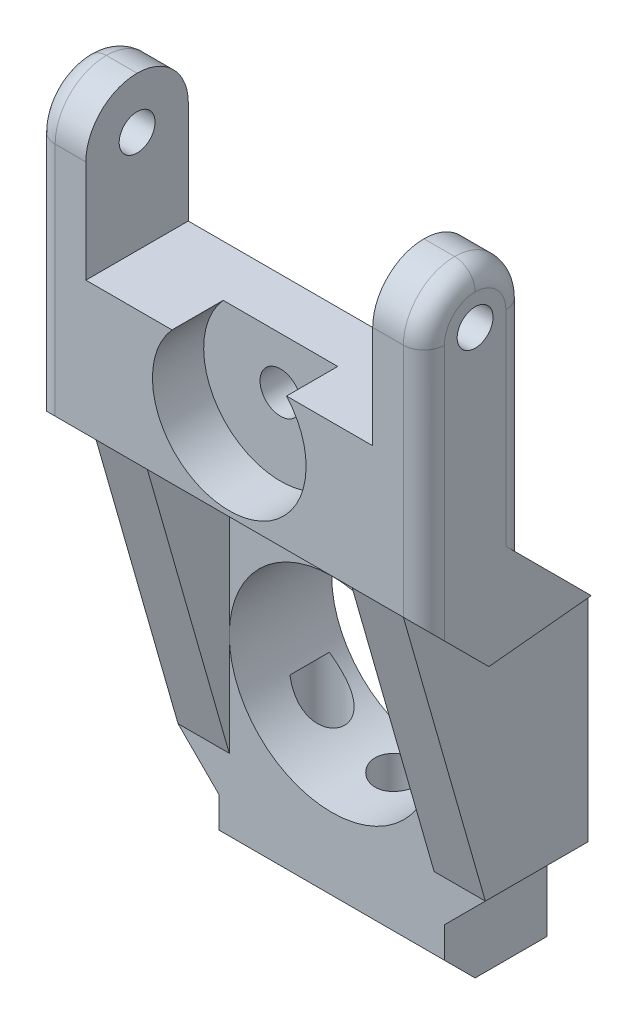
from build123d import *

# Parameters (mm, degrees)
SKETCH1_W           = 30
SKETCH1_H           = 31
BOSS_EXTRUDE1_DEPTH = 10
SKETCH2_W           = 4
SKETCH2_H           = 10
CUT_EXTRUDE1_DEPTH  = 10
CHAMFER1_SIZE       = 4
SKETCH3_R           = 2.25
CUT_EXTRUDE2_DEPTH  = 15
CHAMFER2_SIZE       = 1
SKETCH4_R           = 10
CUT_EXTRUDE3_DEPTH  = 24.774986856
BOSS_EXTRUDE2_DEPTH = 19
CHAMFER3_SIZE       = 4
SKETCH6_W           = 28
SKETCH6_H           = 10
CUT_EXTRUDE4_DEPTH  = 15
FILLET1_R           = 5
SKETCH7_R           = 1.75
CUT_EXTRUDE5_DEPTH  = 68.825142831
FILLET2_R           = 2
SKETCH8_R           = 2
CUT_EXTRUDE6_DEPTH  = 60.306407782
SKETCH9_R           = 7.5
CUT_EXTRUDE7_DEPTH  = 5
BOSS_EXTRUDE3_DEPTH = 5
CHAMFER4_SIZE       = 3


with BuildPart() as part:
    # Sketch1 → Boss-Extrude1 (new body)
    with BuildSketch(Plane.XY):
        Rectangle(SKETCH1_W, SKETCH1_H)
    extrude(amount=BOSS_EXTRUDE1_DEPTH)

    # Sketch2 → Cut-Extrude1 (cut)
    with BuildSketch(Plane.XZ.offset(15.5)):
        with Locations((-13, 5)):
            Rectangle(SKETCH2_W, SKETCH2_H)
        with Locations((13, 5)):
            Rectangle(SKETCH2_W, SKETCH2_H)
    extrude(amount=-CUT_EXTRUDE1_DEPTH, mode=Mode.SUBTRACT)

    # Chamfer1
    chamfer1_edges = [part.edges().sort_by_distance(p)[0] for p in [
        (11, -5.5, 5),
        (-11, -5.5, 5),
    ]]
    chamfer(chamfer1_edges, length=CHAMFER1_SIZE - 0.0001)  # a hair under: the kernel refuses the full size

    # Sketch3 → Cut-Extrude2 (cut)
    with BuildSketch(Plane.XZ.offset(15.5)):
        with Locations(Location((-7.5, 3.5, 0), (0, 0, 270))):
            Circle(SKETCH3_R)
        with Locations(Location((0, 3.5, 0), (0, 0, 270))):
            Circle(SKETCH3_R)
        with Locations(Location((7.5, 3.5, 0), (0, 0, 270))):
            Circle(SKETCH3_R)
    extrude(amount=-CUT_EXTRUDE2_DEPTH, mode=Mode.SUBTRACT)

    # Chamfer2
    chamfer2_edges = [part.edges().sort_by_distance(p)[0] for p in [
        (-7.5, -15.5, 5.75),
        (0, -15.5, 5.75),
        (7.5, -15.5, 5.75),
    ]]
    chamfer(chamfer2_edges, length=CHAMFER2_SIZE)

    # Sketch4 → Cut-Extrude3 (cut, through all)
    with BuildSketch(Plane(origin=(0, 0, 0), x_dir=(-1, 0, 0), z_dir=(0, 0, -1))):
        with Locations((0, 4.5)):
            Circle(SKETCH4_R)
    extrude(amount=-CUT_EXTRUDE3_DEPTH, mode=Mode.SUBTRACT)

    # Sketch5 → Boss-Extrude2 (add, symmetric)
    with BuildSketch(Plane(origin=(0, 0, 0), x_dir=(0, 0, -1), z_dir=(1, 0, 0))):
        Polygon((-10, 14.5), (-20, 24.5), (-20, 52.5), (-10, 52.5), (-10, 25.5), (0, 15.5), align=None)
    extrude(amount=BOSS_EXTRUDE2_DEPTH, both=True)

    # Chamfer3
    chamfer3_edges = [part.edges().sort_by_distance(p)[0] for p in [
        (-19, 15, 5),
        (19, 15, 5),
    ]]
    chamfer(chamfer3_edges, length=CHAMFER3_SIZE - 0.0001)  # a hair under: the kernel refuses the full size

    # Sketch6 → Cut-Extrude4 (cut)
    with BuildSketch(Plane(origin=(0, 52.5, 0), x_dir=(1, 0, 0), z_dir=(0, 1, 0))):
        with Locations((0, -15)):
            Rectangle(SKETCH6_W, SKETCH6_H)
    extrude(amount=-CUT_EXTRUDE4_DEPTH, mode=Mode.SUBTRACT)

    # Fillet1
    fillet1_edges = [part.edges().sort_by_distance(p)[0] for p in [
        (16.5, 52.5, 10),
        (16.5, 52.5, 20),
        (-16.5, 52.5, 10),
        (-16.5, 52.5, 20),
    ]]
    fillet(fillet1_edges, radius=FILLET1_R - 0.0001)  # a hair under: the kernel refuses the full size

    # Sketch7 → Cut-Extrude5 (cut, through all)
    with BuildSketch(Plane(origin=(19, 0, 0), x_dir=(0, 0, -1), z_dir=(1, 0, 0))):
        with Locations((-15, 47.5)):
            Circle(SKETCH7_R)
    extrude(amount=-CUT_EXTRUDE5_DEPTH, mode=Mode.SUBTRACT)

    # Fillet2
    fillet2_edges = [part.edges().sort_by_distance(p)[0] for p in [
        (19, 36.00005, 20),
        (19, 51.035563195, 18.535563195),
        (19, 51.035563195, 11.464436805),
        (-19, 36.00005, 20),
        (-19, 51.035563195, 18.535563195),
        (-19, 51.035563195, 11.464436805),
        (-19, 36.50005, 10),
        (19, 36.50005, 10),
    ]]
    fillet(fillet2_edges, radius=FILLET2_R)

    # Sketch8 → Cut-Extrude6 (cut, through all)
    with BuildSketch(Plane.XY.offset(20)):
        with Locations((0, 32.5)):
            Circle(SKETCH8_R)
    extrude(amount=-CUT_EXTRUDE6_DEPTH, mode=Mode.SUBTRACT)

    # Sketch9 → Cut-Extrude7 (cut)
    with BuildSketch(Plane.XY.offset(20)):
        with Locations((0, 32.5)):
            Circle(SKETCH9_R)
    extrude(amount=-CUT_EXTRUDE7_DEPTH, mode=Mode.SUBTRACT)

    # Sketch10 → Boss-Extrude3 (add)
    with BuildSketch(Plane(origin=(15, 0, 0), x_dir=(0, 0, -1), z_dir=(1, 0, 0))):
        Polygon((-10, -5.5), (-18, 22.5), (-10, 14.5), align=None)
    boss_extrude3 = extrude(amount=-BOSS_EXTRUDE3_DEPTH)

    # Mirror1: Boss-Extrude3 across plane
    add(boss_extrude3.mirror(Plane(origin=(0, 0, 0), x_dir=(0, 0, 1), z_dir=(1, 0, 0))))

    # Chamfer4
    chamfer4_edges = [part.edges().sort_by_distance(p)[0] for p in [
        (0, -15.5, 10),
    ]]
    chamfer(chamfer4_edges, length=CHAMFER4_SIZE)


solid = part.part
